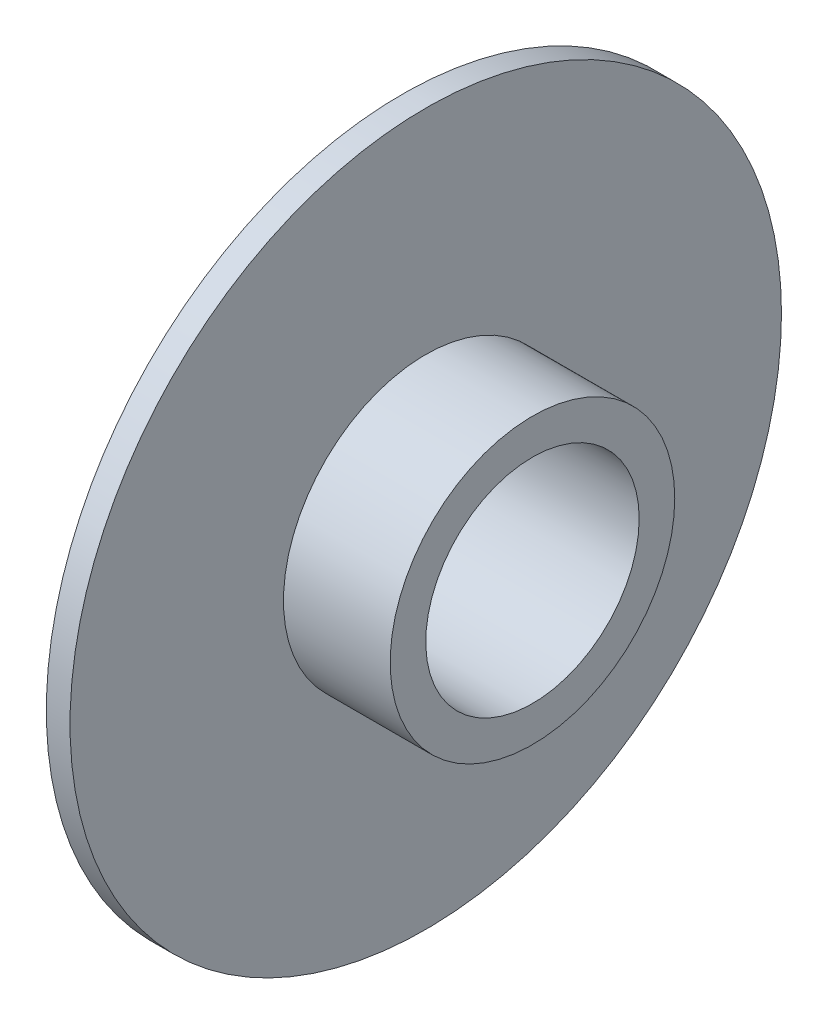
from build123d import *

# Parameters (mm, degrees)
SKETCH1_R           = 60
BOSS_EXTRUDE1_DEPTH = 50
SKETCH1_3_R         = 150
SKETCH1_3_R_2       = 60
BOSS_EXTRUDE2_DEPTH = 5
BOSS_EXTRUDE3_DEPTH = 10


with BuildPart() as part:
    # Sketch1 → Boss-Extrude1 (new, symmetric)
    with BuildSketch(Plane(origin=(0, 0, 0), x_dir=(0, 0, -1), z_dir=(1, 0, 0))):
        Circle(SKETCH1_R)
        with BuildLine():
            ThreePointArc((45, 0), (-30, -33.541019662), (-5, 44.72135955))
            Line((-5, 44.72135955), (-5, 50))
            Line((-5, 50), (5, 50))
            Line((5, 50), (5, 44.72135955))
            ThreePointArc((5, 44.72135955), (33.541019662, 30), (45, 0))
        make_face(mode=Mode.SUBTRACT)
    extrude(amount=BOSS_EXTRUDE1_DEPTH, both=True)

    # Sketch1<3> → Boss-Extrude2 (add, symmetric)
    with BuildSketch(Plane(origin=(0, 0, 0), x_dir=(0, 0, -1), z_dir=(1, 0, 0))):
        Circle(SKETCH1_3_R)
        Circle(SKETCH1_3_R_2, mode=Mode.SUBTRACT)
    extrude(amount=BOSS_EXTRUDE2_DEPTH, both=True)

    # Sketch2 → Boss-Extrude3 (add)
    with BuildSketch(Plane(origin=(50, 0, 0), x_dir=(0, 0, -1), z_dir=(1, 0, 0))):
        with BuildLine():
            Line((-5, 50), (5.072505098, 50))
            Line((5.072505098, 50), (5.072505098, 44.713193713))
            ThreePointArc((5.072505098, 44.713193713), (0.036481742, 44.999985212), (-5, 44.72135955))
            Line((-5, 44.72135955), (-5, 50))
        make_face()
    extrude(amount=-BOSS_EXTRUDE3_DEPTH)


solid = part.part
